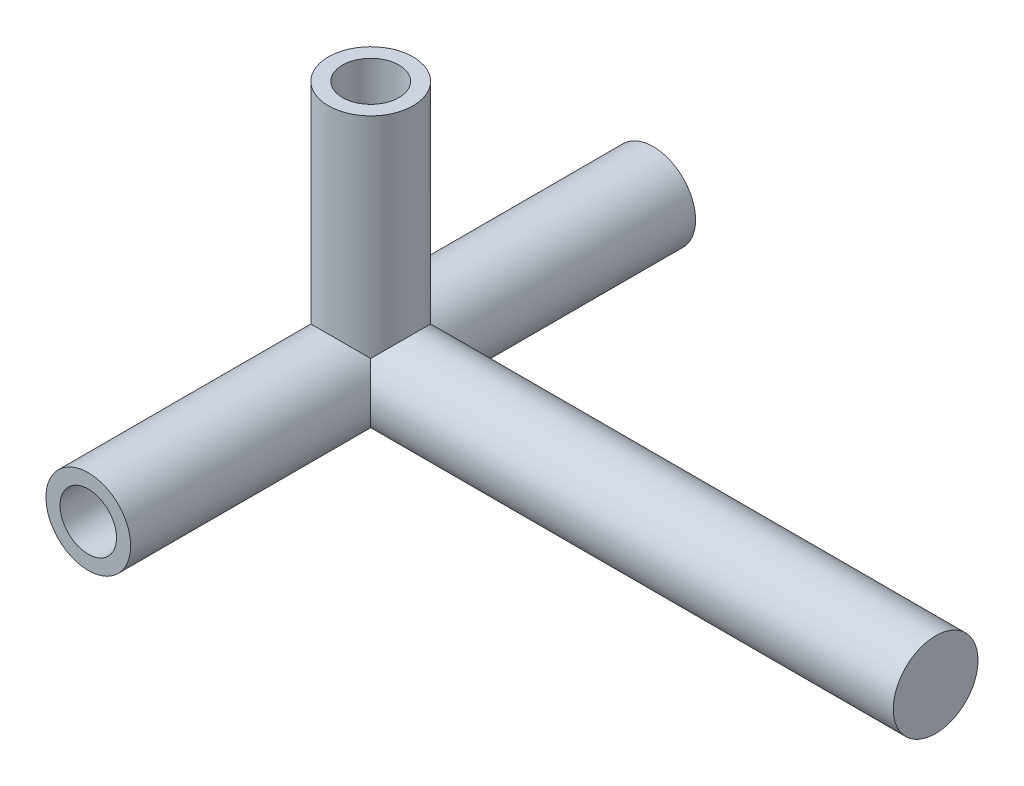
from build123d import *

# Parameters (mm, degrees)
SKETCH1_R                = 3.75
BOSS_EXTRUDE1_DEPTH      = 25
BOSS_EXTRUDE10_START     = -1e-07
BOSS_EXTRUDE10_OUTLINE_R = 3.75
BOSS_EXTRUDE10_DEPTH     = 53.7500002
BOSS_EXTRUDE10_START_2   = -5
BOSS_EXTRUDE10_2_DEPTH   = 10
CUT_REVOLVE2_START       = -5
CUT_REVOLVE2_OUTLINE_W   = 10
CUT_REVOLVE2_OUTLINE_H   = 33.75
CUT_REVOLVE2_DEPTH       = 10
SKETCH10_R               = 3.75
BOSS_EXTRUDE18_DEPTH     = 50
SKETCH11_R               = 2.5
CUT_EXTRUDE12_DEPTH      = 50
CUT_EXTRUDE14_START      = -21.25
SKETCH13_R               = 2.5
CUT_EXTRUDE14_DEPTH      = 21.25


with BuildPart() as part:
    # Sketch1 → Boss-Extrude1 (new, symmetric)
    with BuildSketch(Plane.XY):
        Circle(SKETCH1_R)
    extrude(amount=BOSS_EXTRUDE1_DEPTH, both=True)

    # Boss-Extrude10: read off the stored shape, not the designer's step
    # Boss-Extrude10 outline → Boss-Extrude10 (add)
    with BuildSketch(Plane(origin=(0, 0, 0), x_dir=(1, 0, 0), z_dir=(0, 1, 0)).offset(BOSS_EXTRUDE10_START)):
        Circle(BOSS_EXTRUDE10_OUTLINE_R)
    extrude(amount=BOSS_EXTRUDE10_DEPTH)

    # Boss-Extrude10 2 outline → Boss-Extrude10 2 (cut)
    with BuildSketch(Plane.XY.offset(BOSS_EXTRUDE10_START_2)):
        with BuildLine():
            Line((-5, 50), (-3.75, 50))
            ThreePointArc((-3.75, 50), (-2.651650429, 52.651650429), (0, 53.75))
            Line((0, 53.75), (-5, 53.7500001))
            Line((-5, 53.7500001), (-5, 50))
        make_face()
        with BuildLine():
            Line((5, 53.7500001), (0, 53.75))
            ThreePointArc((0, 53.75), (2.651650429, 52.651650429), (3.75, 50))
            Line((3.75, 50), (5, 50))
            Line((5, 50), (5, 53.7500001))
        make_face()
    extrude(amount=BOSS_EXTRUDE10_2_DEPTH, mode=Mode.SUBTRACT)

    # Cut-Revolve2: read off the stored shape, not the designer's step
    # Cut-Revolve2 outline → Cut-Revolve2 (cut)
    with BuildSketch(Plane(origin=(0, 0, 0), x_dir=(0, 0, -1), z_dir=(1, 0, 0)).offset(CUT_REVOLVE2_START)):
        with Locations((0, 38.125)):
            Rectangle(CUT_REVOLVE2_OUTLINE_W, CUT_REVOLVE2_OUTLINE_H)
    extrude(amount=CUT_REVOLVE2_DEPTH, mode=Mode.SUBTRACT)

    # Sketch10 → Boss-Extrude18 (add)
    with BuildSketch(Plane(origin=(0, 0, 0), x_dir=(0, 0, -1), z_dir=(1, 0, 0))):
        Circle(SKETCH10_R)
    extrude(amount=BOSS_EXTRUDE18_DEPTH)

    # Sketch11 → Cut-Extrude12 (cut)
    with BuildSketch(Plane(origin=(0, 0, -25), x_dir=(-1, 0, 0), z_dir=(0, 0, -1))):
        with Locations(Location((0, 0, 0), (0, 0, 180))):
            Circle(SKETCH11_R)
    extrude(amount=-CUT_EXTRUDE12_DEPTH, mode=Mode.SUBTRACT)

    # Sketch13 → Cut-Extrude14 (cut)
    with BuildSketch(Plane(origin=(0, 21.25, 0), x_dir=(1, 0, 0), z_dir=(0, 1, 0)).offset(CUT_EXTRUDE14_START)):
        with Locations(Location((0, 0, 0), (0, 0, 270))):
            Circle(SKETCH13_R)
    extrude(amount=CUT_EXTRUDE14_DEPTH, mode=Mode.SUBTRACT)


solid = part.part
